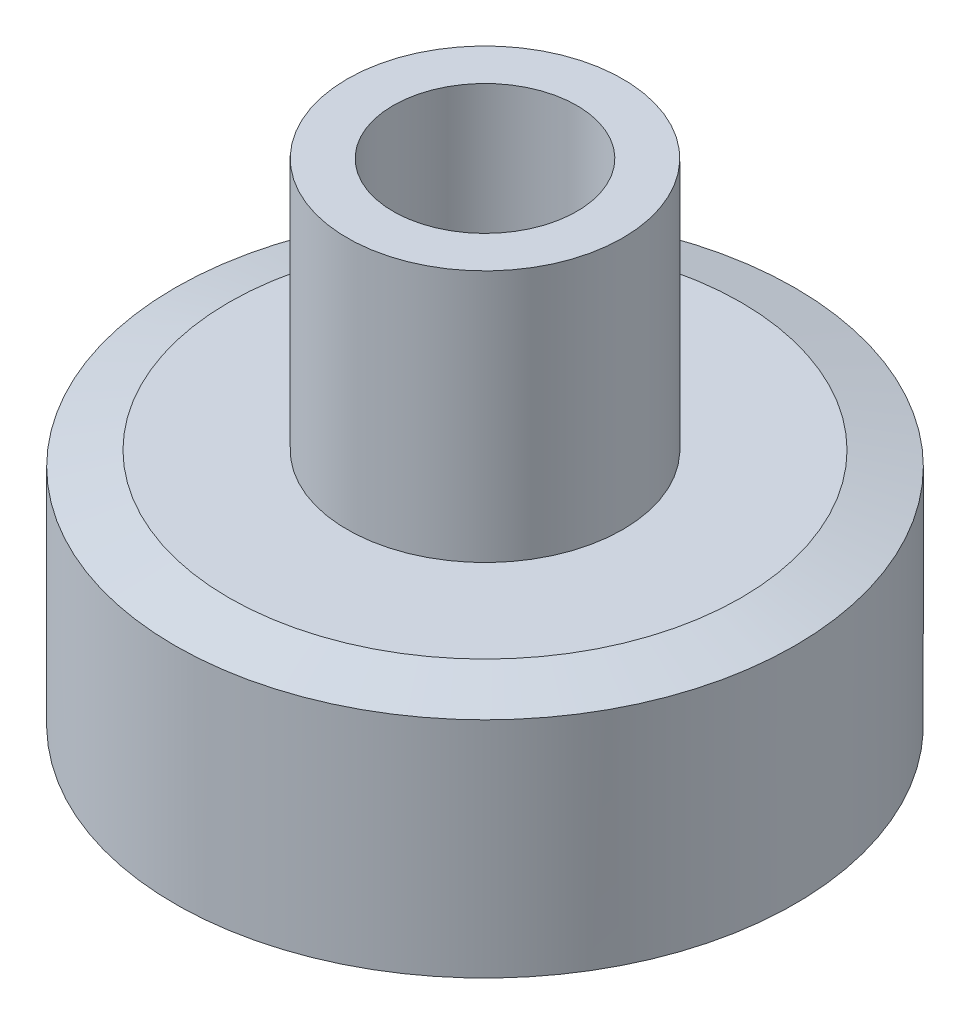
from build123d import *

# Parameters (mm, degrees)
CHAMFER_2_SIZE           = 1.175
CHAMFER_2_SIZE2          = 0.314840301
CHAMFER_3_SIZE           = 1.175
CHAMFER_3_SIZE2          = 0.314840301
CUT_EXTRUDE_2_DEPTH      = 15.564511664
CUT_EXTRUDE_2_DEPTH_BACK = 15.564511664
SKETCH_4_R               = 2


with BuildPart() as part:
    # Эскиз2 → Повернуть2 (revolve)
    with BuildSketch(Plane.XY):
        Polygon((0, 0), (6.75, 0), (6.75, 5.5), (3, 5.5), (3, 11), (0, 11), align=None)
    revolve(axis=Axis((0, 11, 0), (0, -1, 0)))

    # Фаска2
    chamfer_2_edges = [part.edges().sort_by_distance(p)[0] for p in [
        (-6.75, 5.5, 0),
    ]]
    chamfer_2_side = [part.faces().sort_by_distance(p)[0] for p in [
        (-6.559081169, 5.5, 0),
    ]]
    chamfer(chamfer_2_edges, length=CHAMFER_2_SIZE, length2=CHAMFER_2_SIZE2, reference=chamfer_2_side[0])

    # Фаска3
    chamfer_3_edges = [part.edges().sort_by_distance(p)[0] for p in [
        (-6.75, 0, 0),
    ]]
    chamfer_3_side = [part.faces().sort_by_distance(p)[0] for p in [
        (0, 0, 0),
    ]]
    chamfer(chamfer_3_edges, length=CHAMFER_3_SIZE, length2=CHAMFER_3_SIZE2, reference=chamfer_3_side[0])

    # Эскиз4 → Вырез-Вытянуть2 (cut, two sides: drawn at the far end of the back side and taken through both)
    with BuildSketch(Plane(origin=(0, 11, 0), x_dir=(1, 0, 0), z_dir=(0, 1, 0)).offset(-CUT_EXTRUDE_2_DEPTH_BACK)):
        Circle(SKETCH_4_R)
    extrude(amount=CUT_EXTRUDE_2_DEPTH + CUT_EXTRUDE_2_DEPTH_BACK, mode=Mode.SUBTRACT)


solid = part.part
